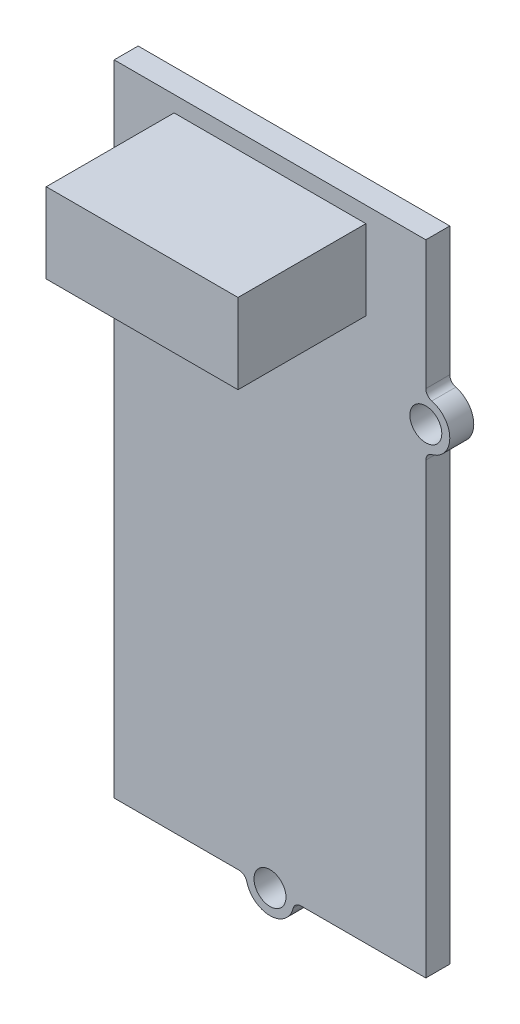
from build123d import *

# Parameters (mm, degrees)
SKETCH_1_W          = 19.5
SKETCH_1_H          = 40
EXTRUDE_1_DEPTH     = 1.5
SKETCH_2_R          = 1.5
EXTRUDE_2_DEPTH     = 1.5
SKETCH_3_R          = 1
CUT_EXTRUDE_1_DEPTH = 1.5
FILLET_1_R          = 0.5
SKETCH_4_W          = 12
SKETCH_4_H          = 5
EXTRUDE_3_DEPTH     = 8


with BuildPart() as part:
    # ｽｹｯﾁ1 → ﾎﾞｽ - 押し出し1 (new body)
    with BuildSketch(Plane.XY):
        Rectangle(SKETCH_1_W, SKETCH_1_H)
    extrude(amount=EXTRUDE_1_DEPTH)

    # ｽｹｯﾁ2 → ﾎﾞｽ - 押し出し2 (add)
    with BuildSketch(Plane.XY.offset(1.5)):
        with Locations((9.75, 10)):
            Circle(SKETCH_2_R)
        with Locations((-9.75, 10)):
            Circle(SKETCH_2_R)
        with Locations((0, -20)):
            Circle(SKETCH_2_R)
    extrude(amount=-EXTRUDE_2_DEPTH)

    # ｽｹｯﾁ3 → ｶｯﾄ - 押し出し1 (cut)
    with BuildSketch(Plane.XY.offset(1.5)):
        with Locations((-9.75, 10)):
            Circle(SKETCH_3_R)
        with Locations((9.75, 10)):
            Circle(SKETCH_3_R)
        with Locations((0, -20)):
            Circle(SKETCH_3_R)
    extrude(amount=-CUT_EXTRUDE_1_DEPTH, mode=Mode.SUBTRACT)

    # ﾌｨﾚｯﾄ1
    fillet_1_edges = [part.edges().sort_by_distance(p)[0] for p in [
        (-9.75, 8.5, 0.75),
        (-9.75, 11.5, 0.75),
        (9.75, 8.5, 0.75),
        (9.75, 11.5, 0.75),
        (-1.5, -20, 0.75),
        (1.5, -20, 0.75),
    ]]
    fillet(fillet_1_edges, radius=FILLET_1_R)

    # ｽｹｯﾁ4 → ﾎﾞｽ - 押し出し3 (add)
    with BuildSketch(Plane.XY.offset(1.5)):
        with Locations((0, 16.5)):
            Rectangle(SKETCH_4_W, SKETCH_4_H)
    extrude(amount=EXTRUDE_3_DEPTH)


solid = part.part
